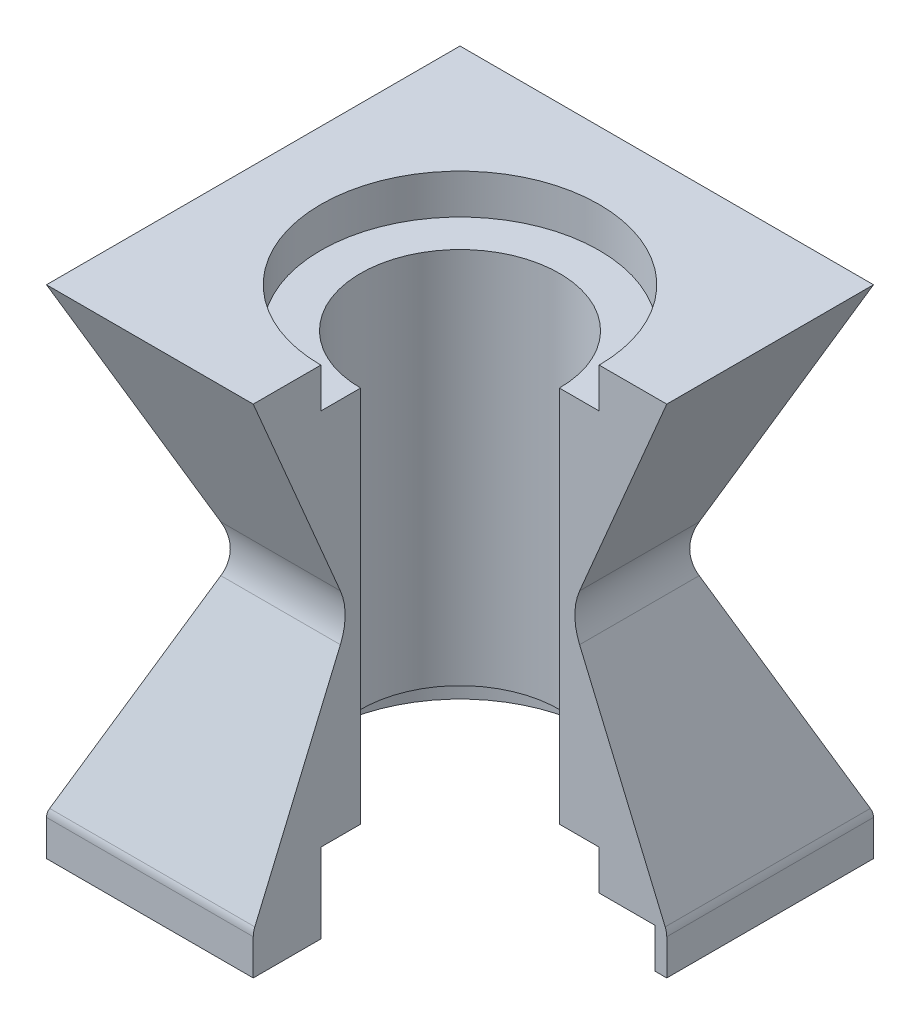
from build123d import *

# Parameters (mm, degrees)
SKETCH1_W           = 104
SKETCH1_H           = 104
BOSS_EXTRUDE1_DEPTH = 57.5
BOSS_EXTRUDE1_TAPER = 23
SKETCH2_R           = 25
CUT_EXTRUDE1_DEPTH  = 187.700294763
FILLET1_R           = 15
SKETCH3_R           = 35
CUT_EXTRUDE2_DEPTH  = 10
CUT_EXTRUDE3_START  = -10
SKETCH4_R           = 35
CUT_EXTRUDE3_DEPTH  = 10
SKETCH5_W           = 52
SKETCH5_H           = 52
CUT_EXTRUDE4_DEPTH  = 187.700294763
BOSS_EXTRUDE2_DEPTH = 10
FILLET2_R           = 5
FILLET3_R           = 5
CUT_EXTRUDE5_DEPTH  = 10


with BuildPart() as part:
    # Sketch1 → Boss-Extrude1 (new body)
    with BuildSketch(Plane(origin=(0, 0, 0), x_dir=(1, 0, 0), z_dir=(0, 1, 0))):
        with Locations((52, 52)):
            Rectangle(SKETCH1_W, SKETCH1_H)
    extrude(amount=BOSS_EXTRUDE1_DEPTH, taper=BOSS_EXTRUDE1_TAPER)

    # Mirror1: part across plane


with BuildPart() as part_1:
    add(part.part)
    add(part.part.mirror(Plane(origin=(0, 57.5, 0), x_dir=(0, 0, 1), z_dir=(0, -1, 0))))

    # Sketch2 → Cut-Extrude1 (cut, through all)
    with BuildSketch(Plane(origin=(0, 115, 0), x_dir=(1, 0, 0), z_dir=(0, 1, 0))):
        with Locations(Location((52, 52, 0), (0, 0, 270))):
            Circle(SKETCH2_R)
    extrude(amount=-CUT_EXTRUDE1_DEPTH, mode=Mode.SUBTRACT)

    # Fillet1
    # the kernel refuses this fillet: 15 mm, written as the material it adds along each edge
    with BuildSketch(Plane(origin=(24.407301932, 57.5, -95.510503676), x_dir=(-0.39073112848927455, -0.9205048534524399, 0), z_dir=(0, 0, 1))) as fillet1_piece_1_section:
        with BuildLine():
            CenterArc((FILLET1_R * 0.42447481621, -FILLET1_R), FILLET1_R, 90, 46)
            Line((-FILLET1_R * 0.294864984129, -FILLET1_R * 0.305341629541), (0, 0))
            Line((0, 0), (FILLET1_R * 0.42447481621, 0))
        make_face()
    fillet1_piece_1 = extrude(amount=87.021007352, mode=Mode.PRIVATE)
    fillet1_piece_1 = fillet1_piece_1 - Plane(origin=(24.407301932, 57.5, -8.111896271), x_dir=(0, -0.39073112848927466, -0.9205048534524399), z_dir=(-1, 0, 0)) * Cylinder(15, 200, mode=Mode.PRIVATE)
    fillet1_piece_1 = fillet1_piece_1 - Plane(origin=(24.407301932, 57.5, -95.888103729), x_dir=(0, -0.3907311284892748, 0.9205048534524398), z_dir=(1, 0, 0)) * Cylinder(15, 200, mode=Mode.PRIVATE)
    add(fillet1_piece_1)
    with BuildSketch(Plane(origin=(8.489496324, 57.5, -24.407301932), x_dir=(0, -0.9205048534524399, 0.39073112848927455), z_dir=(1, 0, 0))) as fillet1_piece_2_section:
        with BuildLine():
            CenterArc((FILLET1_R * 0.42447481621, -FILLET1_R), FILLET1_R, 90, 46)
            Line((-FILLET1_R * 0.294864984129, -FILLET1_R * 0.305341629541), (0, 0))
            Line((0, 0), (FILLET1_R * 0.42447481621, 0))
        make_face()
    fillet1_piece_2 = extrude(amount=87.021007352, mode=Mode.PRIVATE)
    fillet1_piece_2 = fillet1_piece_2 - Plane(origin=(95.888103729, 57.5, -24.407301932), x_dir=(-0.9205048534524398, -0.3907311284892748, 0), z_dir=(0, 0, 1)) * Cylinder(15, 200, mode=Mode.PRIVATE)
    fillet1_piece_2 = fillet1_piece_2 - Plane(origin=(8.111896271, 57.5, -24.407301932), x_dir=(0.9205048534524399, -0.39073112848927466, 0), z_dir=(0, 0, -1)) * Cylinder(15, 200, mode=Mode.PRIVATE)
    add(fillet1_piece_2)
    with BuildSketch(Plane(origin=(79.592698068, 57.5, -8.489496324), x_dir=(0.39073112848927455, -0.9205048534524399, 0), z_dir=(0, 0, -1))) as fillet1_piece_3_section:
        with BuildLine():
            CenterArc((FILLET1_R * 0.42447481621, -FILLET1_R), FILLET1_R, 90, 46)
            Line((-FILLET1_R * 0.294864984129, -FILLET1_R * 0.305341629541), (0, 0))
            Line((0, 0), (FILLET1_R * 0.42447481621, 0))
        make_face()
    fillet1_piece_3 = extrude(amount=87.021007352, mode=Mode.PRIVATE)
    fillet1_piece_3 = fillet1_piece_3 - Plane(origin=(79.592698068, 57.5, -8.111896271), x_dir=(0, -0.39073112848927466, -0.9205048534524399), z_dir=(-1, 0, 0)) * Cylinder(15, 200, mode=Mode.PRIVATE)
    fillet1_piece_3 = fillet1_piece_3 - Plane(origin=(79.592698068, 57.5, -95.888103729), x_dir=(0, -0.3907311284892748, 0.9205048534524398), z_dir=(1, 0, 0)) * Cylinder(15, 200, mode=Mode.PRIVATE)
    add(fillet1_piece_3)
    with BuildSketch(Plane(origin=(95.510503676, 57.5, -79.592698068), x_dir=(0, -0.9205048534524399, -0.39073112848927455), z_dir=(-1, 0, 0))) as fillet1_piece_4_section:
        with BuildLine():
            CenterArc((FILLET1_R * 0.42447481621, -FILLET1_R), FILLET1_R, 90, 46)
            Line((-FILLET1_R * 0.294864984129, -FILLET1_R * 0.305341629541), (0, 0))
            Line((0, 0), (FILLET1_R * 0.42447481621, 0))
        make_face()
    fillet1_piece_4 = extrude(amount=87.021007352, mode=Mode.PRIVATE)
    fillet1_piece_4 = fillet1_piece_4 - Plane(origin=(95.888103729, 57.5, -79.592698068), x_dir=(-0.9205048534524398, -0.3907311284892748, 0), z_dir=(0, 0, 1)) * Cylinder(15, 200, mode=Mode.PRIVATE)
    fillet1_piece_4 = fillet1_piece_4 - Plane(origin=(8.111896271, 57.5, -79.592698068), x_dir=(0.9205048534524399, -0.39073112848927466, 0), z_dir=(0, 0, -1)) * Cylinder(15, 200, mode=Mode.PRIVATE)
    add(fillet1_piece_4)

    # Sketch3 → Cut-Extrude2 (cut)
    with BuildSketch(Plane(origin=(0, 115, 0), x_dir=(1, 0, 0), z_dir=(0, 1, 0))):
        with Locations(Location((52, 52, 0), (0, 0, 270))):
            Circle(SKETCH3_R)
    extrude(amount=-CUT_EXTRUDE2_DEPTH, mode=Mode.SUBTRACT)

    # Sketch4 → Cut-Extrude3 (cut)
    with BuildSketch(Plane.XZ.offset(CUT_EXTRUDE3_START)):
        with Locations(Location((52, -52, 0), (0, 0, 90))):
            Circle(SKETCH4_R)
    extrude(amount=CUT_EXTRUDE3_DEPTH, mode=Mode.SUBTRACT)

    # Sketch5 → Cut-Extrude4 (cut, through all)
    with BuildSketch(Plane(origin=(0, 115, 0), x_dir=(1, 0, 0), z_dir=(0, 1, 0))):
        with Locations((78, 26)):
            Rectangle(SKETCH5_W, SKETCH5_H)
    extrude(amount=-CUT_EXTRUDE4_DEPTH, mode=Mode.SUBTRACT)

    # Sketch7 → Boss-Extrude2 (add)
    with BuildSketch(Plane.XZ):
        Polygon((49, -17), (49, -3), (3, -3), (3, -101), (101, -101), (101, -52), (104, -52), (104, -104), (0, -104), (0, 0), (52, 0), (52, -17), align=None)
    extrude(amount=BOSS_EXTRUDE2_DEPTH)

    # Fillet2
    fillet2_edges = [part_1.edges().sort_by_distance(p)[0] for p in [
        (52, 0, -101),
        (26, 0, 0),
        (0, 0, -52),
        (104, 0, -78),
    ]]
    fillet(fillet2_edges, radius=FILLET2_R)

    # Fillet3
    fillet3_edges = [part_1.edges().sort_by_distance(p)[0] for p in [
        (52, 0, -104),
    ]]
    fillet(fillet3_edges, radius=FILLET3_R)

    # Sketch8 → Cut-Extrude5 (cut)
    with BuildSketch(Plane.XZ):
        with BuildLine():
            Line((14.682837651, -10.358480419), (25.323985369, -20.930423251))
            ThreePointArc((25.323985369, -20.930423251), (25.337826346, -25.173041361), (21.095208236, -25.186882338))
            Line((21.095208236, -25.186882338), (10.454060518, -14.614939506))
            ThreePointArc((10.454060518, -14.614939506), (10.440219541, -10.372321396), (14.682837651, -10.358480419))
        make_face()
        with BuildLine():
            Line((14.682837651, -93.641519581), (25.323985369, -83.069576749))
            ThreePointArc((25.323985369, -83.069576749), (25.337826346, -78.826958639), (21.095208236, -78.813117662))
            Line((21.095208236, -78.813117662), (10.454060518, -89.385060494))
            ThreePointArc((10.454060518, -89.385060494), (10.440219541, -93.627678604), (14.682837651, -93.641519581))
        make_face()
        with BuildLine():
            Line((93.938828765, -88.715537796), (83.246195736, -78.19567093))
            ThreePointArc((83.246195736, -78.19567093), (79.003695757, -78.230224162), (79.038248989, -82.472724142))
            Line((79.038248989, -82.472724142), (89.730882019, -92.992591008))
            ThreePointArc((89.730882019, -92.992591008), (93.973381998, -92.958037776), (93.938828765, -88.715537796))
        make_face()
    extrude(amount=-CUT_EXTRUDE5_DEPTH, mode=Mode.SUBTRACT)


solid = part_1.part
